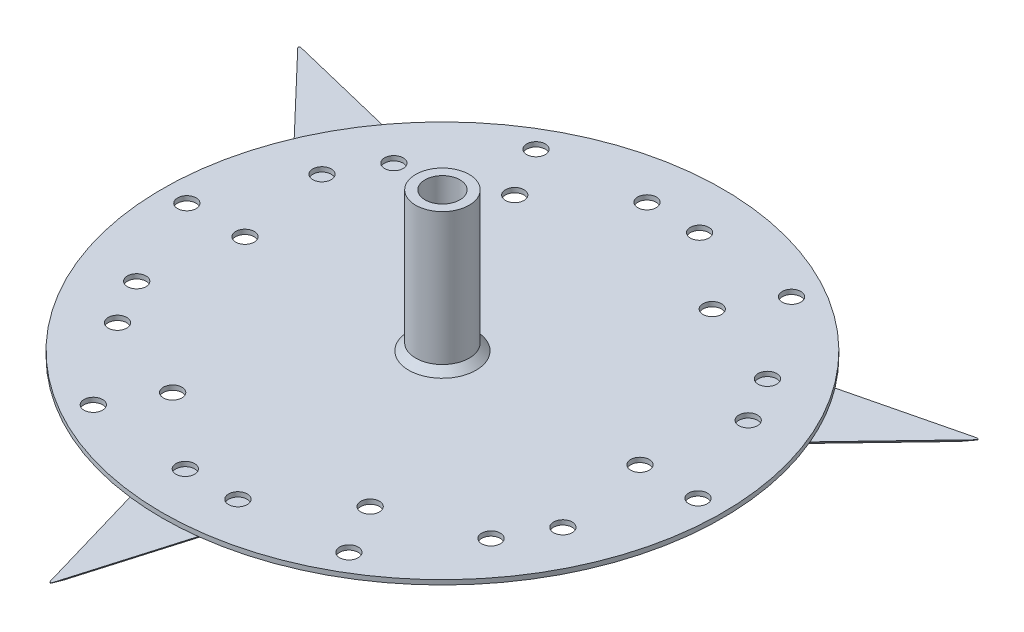
from build123d import *

# Parameters (mm, degrees)
SKETCH1_R           = 120.65
SKETCH1_R_2         = 7.5
SKETCH1_R_3         = 4
BOSS_EXTRUDE1_DEPTH = 2
SKETCH2_R           = 11.5
SKETCH2_R_2         = 7.5
BOSS_EXTRUDE2_DEPTH = 60
BOSS_EXTRUDE3_DEPTH = 2
CHAMFER1_SIZE       = 3
CHAMFER8_SIZE       = 2


with BuildPart() as part:
    # Sketch1 → Boss-Extrude1 (new body)
    with BuildSketch(Plane(origin=(0, 0, 0), x_dir=(1, 0, 0), z_dir=(0, 1, 0))):
        with Locations(Location((0, 0, 0), (0, 0, 270))):
            Circle(SKETCH1_R)
        with Locations(Location((0, 0, 0), (0, 0, 270))):
            Circle(SKETCH1_R_2, mode=Mode.SUBTRACT)
        with Locations(Location((-85, 0, 0), (0, 0, 270))):
            Circle(SKETCH1_R_3, mode=Mode.SUBTRACT)
        with Locations(Location((-42.5, 73.612159322, 0), (0, 0, 270))):
            Circle(SKETCH1_R_3, mode=Mode.SUBTRACT)
        with Locations(Location((42.5, 73.612159322, 0), (0, 0, 270))):
            Circle(SKETCH1_R_3, mode=Mode.SUBTRACT)
        with Locations(Location((85, 0, 0), (0, 0, 270))):
            Circle(SKETCH1_R_3, mode=Mode.SUBTRACT)
        with Locations(Location((42.5, -73.612159322, 0), (0, 0, 270))):
            Circle(SKETCH1_R_3, mode=Mode.SUBTRACT)
        with Locations(Location((-42.5, -73.612159322, 0), (0, 0, 270))):
            Circle(SKETCH1_R_3, mode=Mode.SUBTRACT)
        with Locations(Location((-110, 0, 0), (0, 0, 270))):
            Circle(SKETCH1_R_3, mode=Mode.SUBTRACT)
        with Locations(Location((-55, 95.262794416, 0), (0, 0, 270))):
            Circle(SKETCH1_R_3, mode=Mode.SUBTRACT)
        with Locations(Location((55, 95.262794416, 0), (0, 0, 270))):
            Circle(SKETCH1_R_3, mode=Mode.SUBTRACT)
        with Locations(Location((110, 0, 0), (0, 0, 270))):
            Circle(SKETCH1_R_3, mode=Mode.SUBTRACT)
        with Locations(Location((55, -95.262794416, 0), (0, 0, 270))):
            Circle(SKETCH1_R_3, mode=Mode.SUBTRACT)
        with Locations(Location((-55, -95.262794416, 0), (0, 0, 270))):
            Circle(SKETCH1_R_3, mode=Mode.SUBTRACT)
        with Locations(Location((-11.320321377, 99.357185568, 0), (0, 0, 270))):
            Circle(SKETCH1_R_3, mode=Mode.SUBTRACT)
        with Locations(Location((11.320321377, 99.357185568, 0), (0, 0, 270))):
            Circle(SKETCH1_R_3, mode=Mode.SUBTRACT)
        with Locations(Location((91.706007439, 39.874906893, 0), (0, 0, 270))):
            Circle(SKETCH1_R_3, mode=Mode.SUBTRACT)
        with Locations(Location((80.385686062, 59.482278675, 0), (0, 0, 270))):
            Circle(SKETCH1_R_3, mode=Mode.SUBTRACT)
        with Locations(Location((80.385686062, -59.482278675, 0), (0, 0, 270))):
            Circle(SKETCH1_R_3, mode=Mode.SUBTRACT)
        with Locations(Location((91.706007439, -39.874906893, 0), (0, 0, 270))):
            Circle(SKETCH1_R_3, mode=Mode.SUBTRACT)
        with Locations(Location((-11.320321377, -99.357185568, 0), (0, 0, 270))):
            Circle(SKETCH1_R_3, mode=Mode.SUBTRACT)
        with Locations(Location((11.320321377, -99.357185568, 0), (0, 0, 270))):
            Circle(SKETCH1_R_3, mode=Mode.SUBTRACT)
        with Locations(Location((-91.706007439, -39.874906893, 0), (0, 0, 270))):
            Circle(SKETCH1_R_3, mode=Mode.SUBTRACT)
        with Locations(Location((-80.385686062, -59.482278675, 0), (0, 0, 270))):
            Circle(SKETCH1_R_3, mode=Mode.SUBTRACT)
        with Locations(Location((-80.385686062, 59.482278675, 0), (0, 0, 270))):
            Circle(SKETCH1_R_3, mode=Mode.SUBTRACT)
        with Locations(Location((-91.706007439, 39.874906893, 0), (0, 0, 270))):
            Circle(SKETCH1_R_3, mode=Mode.SUBTRACT)
    extrude(amount=BOSS_EXTRUDE1_DEPTH)

    # Sketch2 → Boss-Extrude2 (add)
    with BuildSketch(Plane(origin=(0, 2, 0), x_dir=(1, 0, 0), z_dir=(0, 1, 0))):
        with Locations(Location((0, 0, 0), (0, 0, 270))):
            Circle(SKETCH2_R)
        with Locations(Location((0, 0, 0), (0, 0, 270))):
            Circle(SKETCH2_R_2, mode=Mode.SUBTRACT)
    extrude(amount=BOSS_EXTRUDE2_DEPTH)

    # Sketch3 → Revolve1 (revolve)
    with BuildSketch(Plane.XY, mode=Mode.PRIVATE) as revolve1_sk:
        with BuildLine():
            Line((0, 0), (15, 0))
            ThreePointArc((15, 0), (14.880445444, -1.890064387), (14.523687548, -3.75))
            ThreePointArc((14.523687548, -3.75), (12.744320544, -6.452847075), (9.682458366, -7.5))
            Line((9.682458366, -7.5), (0, -7.5))
            Line((0, -7.5), (0, 0))
        make_face()
    revolve(revolve1_sk.sketch.rotate(Axis((0, 0, 0), (0, -1, 0)), 90), axis=Axis((0, 0, 0), (0, -1, 0)))

    # Sketch4 → Boss-Extrude3 (add)
    with BuildSketch(Plane.XZ):
        with BuildLine():
            Line((-19, 90), (19, 90))
            Line((19, 90), (19, 105))
            Line((19, 105), (0.479917223, 168.358177922))
            ThreePointArc((0.479917223, 168.358177922), (0, 168.717894426), (-0.479917223, 168.358177922))
            Line((-0.479917223, 168.358177922), (-19, 105))
            Line((-19, 105), (-19, 90))
        make_face()
        with BuildLine():
            Line((81.432667397, -68.954482672), (145.562500404, -84.594709468))
            ThreePointArc((145.562500404, -84.594709468), (146.113982646, -84.358947213), (146.042417627, -83.763468454))
            Line((146.042417627, -83.763468454), (100.432667397, -36.045517328))
            Line((100.432667397, -36.045517328), (87.442286341, -28.545517328))
            Line((87.442286341, -28.545517328), (68.442286341, -61.454482672))
            Line((68.442286341, -61.454482672), (81.432667397, -68.954482672))
        make_face()
        with BuildLine():
            Line((-100.432667397, -36.045517328), (-146.042417627, -83.763468454))
            ThreePointArc((-146.042417627, -83.763468454), (-146.113982646, -84.358947213), (-145.562500404, -84.594709468))
            Line((-145.562500404, -84.594709468), (-81.432667397, -68.954482672))
            Line((-81.432667397, -68.954482672), (-68.442286341, -61.454482672))
            Line((-68.442286341, -61.454482672), (-87.442286341, -28.545517328))
            Line((-87.442286341, -28.545517328), (-100.432667397, -36.045517328))
        make_face()
    extrude(amount=BOSS_EXTRUDE3_DEPTH)

    # Chamfer1
    chamfer1_edges = [part.edges().sort_by_distance(p)[0] for p in [
        (0, 2, -11.5),
    ]]
    chamfer(chamfer1_edges, length=CHAMFER1_SIZE)

    # Chamfer8
    # the kernel refuses this chamfer: 2 mm, written as the material it takes off along each edge
    with BuildSketch(Plane(origin=(-94.391126841, -2, -29.724721105), x_dir=(0, 1, 0), z_dir=(-0.690957517475874, 0, -0.7228953652110223)), Plane(origin=(-150.55940651, -2, -85.813373872), x_dir=(0, 1, 0), z_dir=(0.9715245092887052, 0, 0.2369390804644533)), Plane(origin=(0.963141497, -2, 173.294957752), x_dir=(0, 1, 0), z_dir=(-0.2805669918128247, 0, -0.9598344456754521)), Plane(origin=(21.453199823, -2, 96.607474288), x_dir=(0, 1, 0), z_dir=(-0.2805669918128244, 0, 0.9598344456754522)), Plane(origin=(149.596265013, -2, -87.48158388), x_dir=(0, 1, 0), z_dir=(-0.6909575174758892, 0, 0.7228953652110078)), Plane(origin=(72.937927017, -2, -66.882753184), x_dir=(0, 1, 0), z_dir=(0.9715245092887104, 0, -0.23693908046443202))) as chamfer8_piece_1:
        Polygon((CHAMFER8_SIZE, 0), (0, CHAMFER8_SIZE), (0, 0), align=None)
    extrude(amount=79.896573633, mode=Mode.SUBTRACT)
    with BuildSketch(Plane(origin=(145.680969944, -2, -84.108947213), x_dir=(-0.2369390804643702, 0, -0.9715245092887255), z_dir=(-0.9715245092887255, 0, 0.2369390804643702))) as chamfer8_piece_2_section:
        Polygon((0.5, -CHAMFER8_SIZE), (0, -1.5), (0, 0), (0.5, 0), align=None)
    chamfer8_piece_2 = revolve(axis=Axis((145.680969944, -2, -84.108947213), (0, -1, 0)), revolution_arc=147.411905087, mode=Mode.PRIVATE)
    chamfer8_piece_2 = split(chamfer8_piece_2, bisect_by=Plane(origin=(145.858674254, -1.25, -83.380303831), z_dir=(-0.16754123052450473, -0.7071067811865483, -0.6869715686069793)), keep=Keep.TOP, mode=Mode.PRIVATE)
    add(chamfer8_piece_2, mode=Mode.SUBTRACT)
    with BuildSketch(Plane(origin=(145.680969944, -2, -84.108947213), x_dir=(-0.2369390804643702, 0, -0.9715245092887255), z_dir=(-0.9715245092887255, 0, 0.2369390804643702))) as chamfer8_piece_3_section:
        Polygon((0.5, -CHAMFER8_SIZE), (0, -1.5), (0, 0), (0.5, 0), align=None)
    chamfer8_piece_3 = revolve(axis=Axis((145.680969944, -2, -84.108947213), (0, -1, 0)), revolution_arc=147.411905087, mode=Mode.PRIVATE)
    chamfer8_piece_3 = split(chamfer8_piece_3, bisect_by=Plane(origin=(145.13879842, -1.25, -84.627165351), z_dir=(0.5111642148290308, -0.7071067811865457, 0.4885807461190251)), keep=Keep.TOP, mode=Mode.PRIVATE)
    add(chamfer8_piece_3, mode=Mode.SUBTRACT)
    with BuildSketch(Plane(origin=(0, -2, 168.217894426), x_dir=(0.9598344456754415, 0, 0.2805669918128611), z_dir=(0.2805669918128611, 0, -0.9598344456754415))) as chamfer8_piece_4_section:
        Polygon((0.5, -CHAMFER8_SIZE), (0, -1.5), (0, 0), (0.5, 0), align=None)
    chamfer8_piece_4 = revolve(axis=Axis((0, -2, 168.217894426), (0, -1, 0)), revolution_arc=147.411905087, mode=Mode.PRIVATE)
    chamfer8_piece_4 = split(chamfer8_piece_4, bisect_by=Plane(origin=(-0.719875834, -1.25, 168.007469182), z_dir=(0.678705445353544, -0.7071067811865469, 0.19839082248795895)), keep=Keep.TOP, mode=Mode.PRIVATE)
    add(chamfer8_piece_4, mode=Mode.SUBTRACT)
    with BuildSketch(Plane(origin=(0, -2, 168.217894426), x_dir=(0.9598344456754415, 0, 0.2805669918128611), z_dir=(0.2805669918128611, 0, -0.9598344456754415))) as chamfer8_piece_5_section:
        Polygon((0.5, -CHAMFER8_SIZE), (0, -1.5), (0, 0), (0.5, 0), align=None)
    chamfer8_piece_5 = revolve(axis=Axis((0, -2, 168.217894426), (0, -1, 0)), revolution_arc=147.411905087, mode=Mode.PRIVATE)
    chamfer8_piece_5 = split(chamfer8_piece_5, bisect_by=Plane(origin=(0.719875834, -1.25, 168.007469182), z_dir=(-0.6787054453535436, -0.707106781186547, 0.19839082248795903)), keep=Keep.TOP, mode=Mode.PRIVATE)
    add(chamfer8_piece_5, mode=Mode.SUBTRACT)
    with BuildSketch(Plane(origin=(-145.680969944, -2, -84.108947213), x_dir=(-0.7228953652110097, 0, 0.6909575174758872), z_dir=(0.6909575174758872, 0, 0.7228953652110097))) as chamfer8_piece_6_section:
        Polygon((0.5, -CHAMFER8_SIZE), (0, -1.5), (0, 0), (0.5, 0), align=None)
    chamfer8_piece_6 = revolve(axis=Axis((-145.680969944, -2, -84.108947213), (0, -1, 0)), revolution_arc=147.411905087, mode=Mode.PRIVATE)
    chamfer8_piece_6 = split(chamfer8_piece_6, bisect_by=Plane(origin=(-145.13879842, -1.25, -84.627165351), z_dir=(-0.5111642148290398, -0.7071067811865479, 0.488580746119013)), keep=Keep.TOP, mode=Mode.PRIVATE)
    add(chamfer8_piece_6, mode=Mode.SUBTRACT)
    with BuildSketch(Plane(origin=(-145.680969944, -2, -84.108947213), x_dir=(-0.7228953652110097, 0, 0.6909575174758872), z_dir=(0.6909575174758872, 0, 0.7228953652110097))) as chamfer8_piece_7_section:
        Polygon((0.5, -CHAMFER8_SIZE), (0, -1.5), (0, 0), (0.5, 0), align=None)
    chamfer8_piece_7 = revolve(axis=Axis((-145.680969944, -2, -84.108947213), (0, -1, 0)), revolution_arc=147.411905087, mode=Mode.PRIVATE)
    chamfer8_piece_7 = split(chamfer8_piece_7, bisect_by=Plane(origin=(-145.858674254, -1.25, -83.380303831), z_dir=(0.16754123052451989, -0.7071067811865478, -0.6869715686069761)), keep=Keep.TOP, mode=Mode.PRIVATE)
    add(chamfer8_piece_7, mode=Mode.SUBTRACT)


solid = part.part
